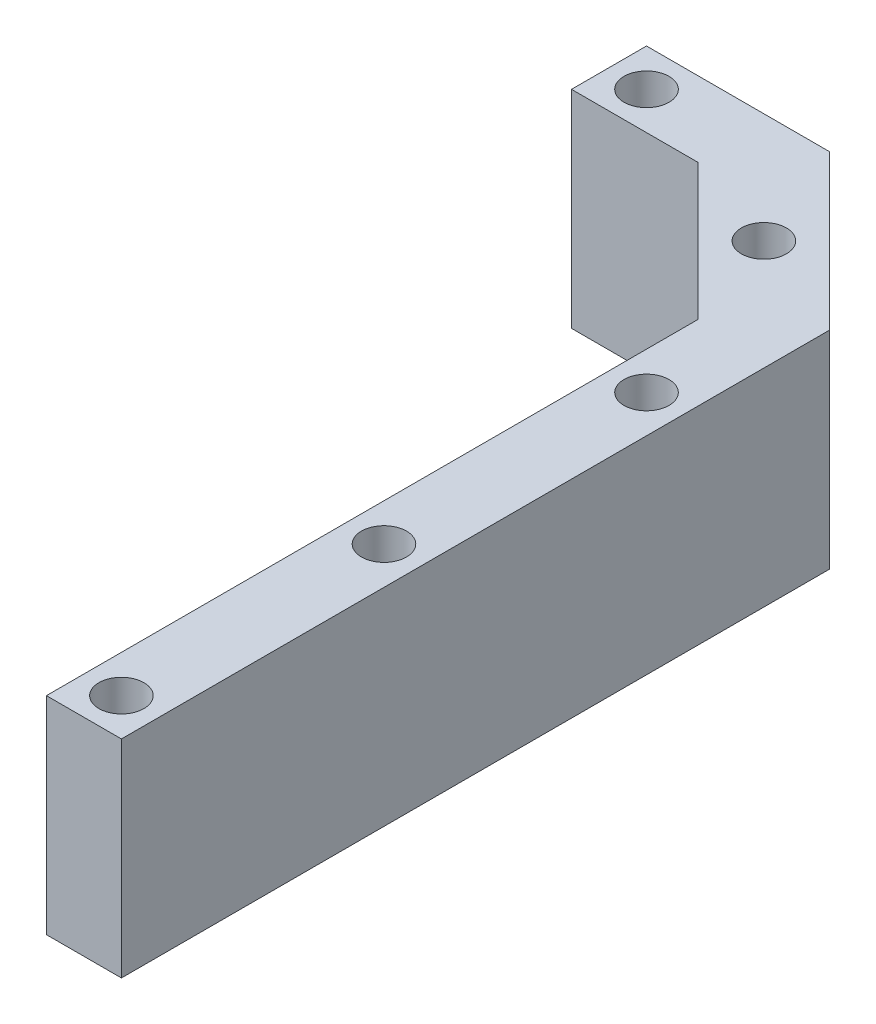
from build123d import *

# Parameters (mm, degrees)
SKETCH_2_R          = 1.5
EXTRUDE_1_DEPTH     = 13.8
CUT_EXTRUDE_1_REACH = 84.782
SKETCH_3_R          = 1.5
SKETCH_4_W          = 9.792919804
SKETCH_4_H          = 7.307876204
CUT_EXTRUDE_2_DEPTH = 57.852448576


with BuildPart() as part:
    # 草图2 → 凸台-拉伸1 (new body)
    with BuildSketch(Plane(origin=(0, 0, 0), x_dir=(1, 0, 0), z_dir=(0, 1, 0))):
        Polygon((-37.5, -15), (-37.5, -20), (-29.053978417, -20), (-20, -29.053978417), (-20, -37.5), (-20, -72.5), (-15, -72.5), (-15, -37.5), (-15, -25.296902378), (-25.296902378, -15), align=None)
        with Locations((-35, -17.5)):
            Circle(SKETCH_2_R, mode=Mode.SUBTRACT)
        with Locations((-17.5, -35)):
            Circle(SKETCH_2_R, mode=Mode.SUBTRACT)
        with Locations((-17.5, -52.5)):
            Circle(SKETCH_2_R, mode=Mode.SUBTRACT)
        with Locations((-17.5, -70)):
            Circle(SKETCH_2_R, mode=Mode.SUBTRACT)
    extrude(amount=EXTRUDE_1_DEPTH)

    # 草图3 → 切除-拉伸1 (cut, up to next)
    with BuildSketch(Plane(origin=(0, 13.8, 0), x_dir=(1, 0, 0), z_dir=(0, 1, 0)), mode=Mode.PRIVATE) as cut_extrude_1_sk1:
        with Locations((-22.337720199, -22.337720199)):
            Circle(SKETCH_3_R)
    cut_extrude_1_tool1 = extrude(cut_extrude_1_sk1.sketch, amount=-CUT_EXTRUDE_1_REACH, mode=Mode.PRIVATE) & part.part
    add(cut_extrude_1_tool1.solids().sort_by_distance((-22.33772, 13.8, 22.33772))[0], mode=Mode.SUBTRACT)

    # 草图4 → 切除-拉伸2 (cut, through all)
    with BuildSketch(Plane(origin=(-20.148451189, 0, 20.148451189), x_dir=(-0.7071067811865477, 0, -0.7071067811865475), z_dir=(0.7071067811865475, 0, -0.7071067811865477))):
        with Locations((0, 6.9)):
            Rectangle(SKETCH_4_W, SKETCH_4_H)
    extrude(amount=-CUT_EXTRUDE_2_DEPTH, mode=Mode.SUBTRACT)


solid = part.part
